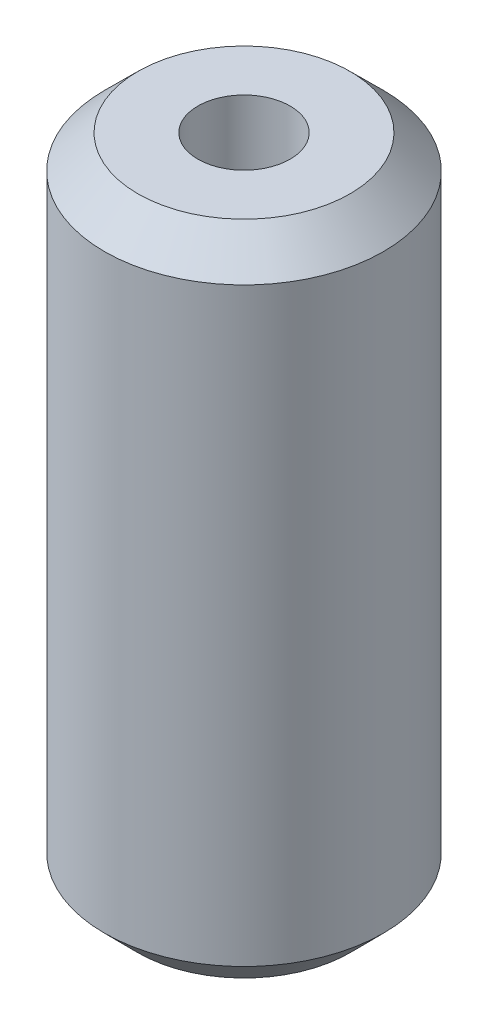
from build123d import *
from OCP.BRepFilletAPI import BRepFilletAPI_MakeChamfer

# Parameters (mm, degrees)
SKETCH1_R           = 5
BOSS_EXTRUDE1_DEPTH = 23.537935638
SKETCH2_R           = 1.651989336
CUT_EXTRUDE1_DEPTH  = 25.57711159
CHAMFER1_SIZE       = 1.191273504
CHAMFER1_SIZE2      = 1.200072359


with BuildPart() as part:
    # Sketch1 → Boss-Extrude1 (new body)
    with BuildSketch(Plane(origin=(0, 0, 0), x_dir=(1, 0, 0), z_dir=(0, 1, 0))):
        Circle(SKETCH1_R)
    extrude(amount=BOSS_EXTRUDE1_DEPTH)

    # Sketch2 → Cut-Extrude1 (cut, through all)
    with BuildSketch(Plane(origin=(0, 0, 0), x_dir=(1, 0, 0), z_dir=(0, 1, 0))):
        Circle(SKETCH2_R)
    extrude(amount=CUT_EXTRUDE1_DEPTH, mode=Mode.SUBTRACT)

    # Chamfer1: one chamfer whose edges measure the first distance from different faces: ONE call of the kernel's chamfer builder (chamfer() names one face for all edges)
    chamfer1_edges_1 = [part.edges().sort_by_distance(p)[0] for p in [
        (-5, 23.537935638, 0),
    ]]
    chamfer1_side_1 = [part.faces().sort_by_distance(p)[0] for p in [
        (-5, 11.768967819, 0),
    ]]
    chamfer1_edges_2 = [part.edges().sort_by_distance(p)[0] for p in [
        (-5, 0, 0),
    ]]
    chamfer1_side_2 = [part.faces().sort_by_distance(p)[0] for p in [
        (-4.858578644, 0, 0),
    ]]
    chamfer1 = BRepFilletAPI_MakeChamfer(part.part.solid().wrapped)
    for e in chamfer1_edges_1:
        chamfer1.Add(CHAMFER1_SIZE, CHAMFER1_SIZE2, e.wrapped, chamfer1_side_1[0].wrapped)  # the first distance lies on this face
    for e in chamfer1_edges_2:
        chamfer1.Add(CHAMFER1_SIZE, CHAMFER1_SIZE2, e.wrapped, chamfer1_side_2[0].wrapped)  # the first distance lies on this face
    add(Compound.cast(chamfer1.Shape()), mode=Mode.REPLACE)


solid = part.part
